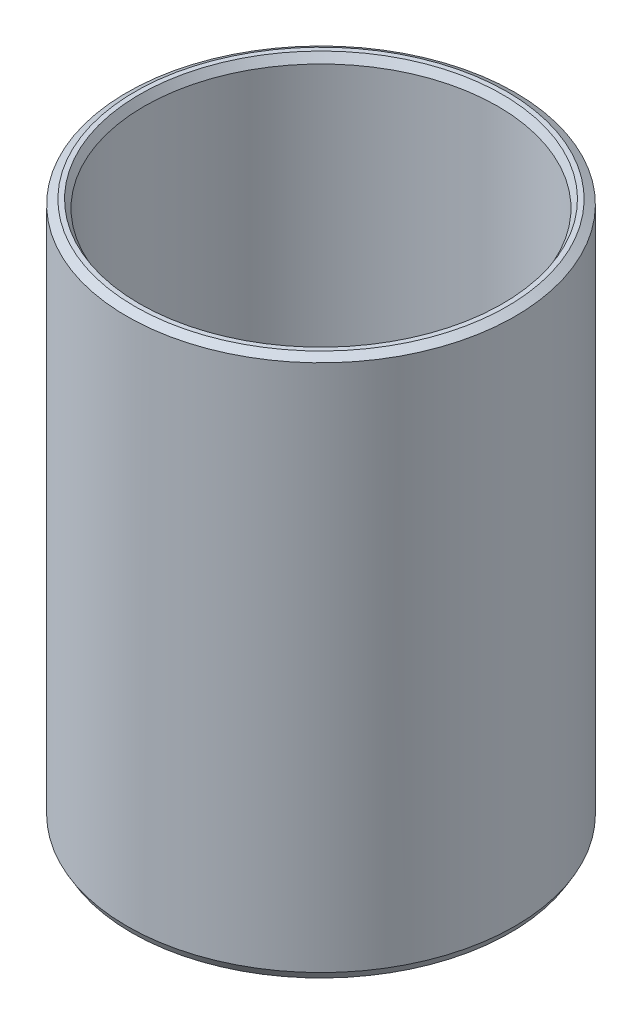
from build123d import *
from OCP.BRepFilletAPI import BRepFilletAPI_MakeChamfer

# Parameters (mm, degrees)
SKETCH1_R           = 50
BOSS_EXTRUDE1_DEPTH = 139.315577433
SKETCH2_R           = 45.554895374
CUT_EXTRUDE1_DEPTH  = 157.233255472
CHAMFER1_SIZE       = 1.184489818
CHAMFER1_SIZE2      = 2.051596545


with BuildPart() as part:
    # Sketch1 → Boss-Extrude1 (new body)
    with BuildSketch(Plane(origin=(0, 0, 0), x_dir=(1, 0, 0), z_dir=(0, 1, 0))):
        Circle(SKETCH1_R)
    extrude(amount=BOSS_EXTRUDE1_DEPTH)

    # Sketch2 → Cut-Extrude1 (cut, through all)
    with BuildSketch(Plane(origin=(0, 0, 0), x_dir=(1, 0, 0), z_dir=(0, 1, 0))):
        Circle(SKETCH2_R)
    extrude(amount=CUT_EXTRUDE1_DEPTH, mode=Mode.SUBTRACT)

    # Chamfer1: one chamfer whose edges measure the first distance from different faces: ONE call of the kernel's chamfer builder (chamfer() names one face for all edges)
    chamfer1_edges_1 = [part.edges().sort_by_distance(p)[0] for p in [
        (-45.554895374, 139.315577433, 0),
    ]]
    chamfer1_side_1 = [part.faces().sort_by_distance(p)[0] for p in [
        (-48.585786438, 139.315577433, 0),
    ]]
    chamfer1_edges_2 = [part.edges().sort_by_distance(p)[0] for p in [
        (-45.554895374, 0, 0),
    ]]
    chamfer1_side_2 = [part.faces().sort_by_distance(p)[0] for p in [
        (-45.554895374, 69.657788716, 0),
    ]]
    chamfer1_edges_3 = [part.edges().sort_by_distance(p)[0] for p in [
        (-50, 0, 0),
    ]]
    chamfer1_side_3 = [part.faces().sort_by_distance(p)[0] for p in [
        (-48.585786438, 0, 0),
    ]]
    chamfer1_edges_4 = [part.edges().sort_by_distance(p)[0] for p in [
        (-50, 139.315577433, 0),
    ]]
    chamfer1_side_4 = [part.faces().sort_by_distance(p)[0] for p in [
        (-50, 69.657788716, 0),
    ]]
    chamfer1 = BRepFilletAPI_MakeChamfer(part.part.solid().wrapped)
    for e in chamfer1_edges_1:
        chamfer1.Add(CHAMFER1_SIZE, CHAMFER1_SIZE2, e.wrapped, chamfer1_side_1[0].wrapped)  # the first distance lies on this face
    for e in chamfer1_edges_2:
        chamfer1.Add(CHAMFER1_SIZE, CHAMFER1_SIZE2, e.wrapped, chamfer1_side_2[0].wrapped)  # the first distance lies on this face
    for e in chamfer1_edges_3:
        chamfer1.Add(CHAMFER1_SIZE, CHAMFER1_SIZE2, e.wrapped, chamfer1_side_3[0].wrapped)  # the first distance lies on this face
    for e in chamfer1_edges_4:
        chamfer1.Add(CHAMFER1_SIZE, CHAMFER1_SIZE2, e.wrapped, chamfer1_side_4[0].wrapped)  # the first distance lies on this face
    add(Compound.cast(chamfer1.Shape()), mode=Mode.REPLACE)


solid = part.part
